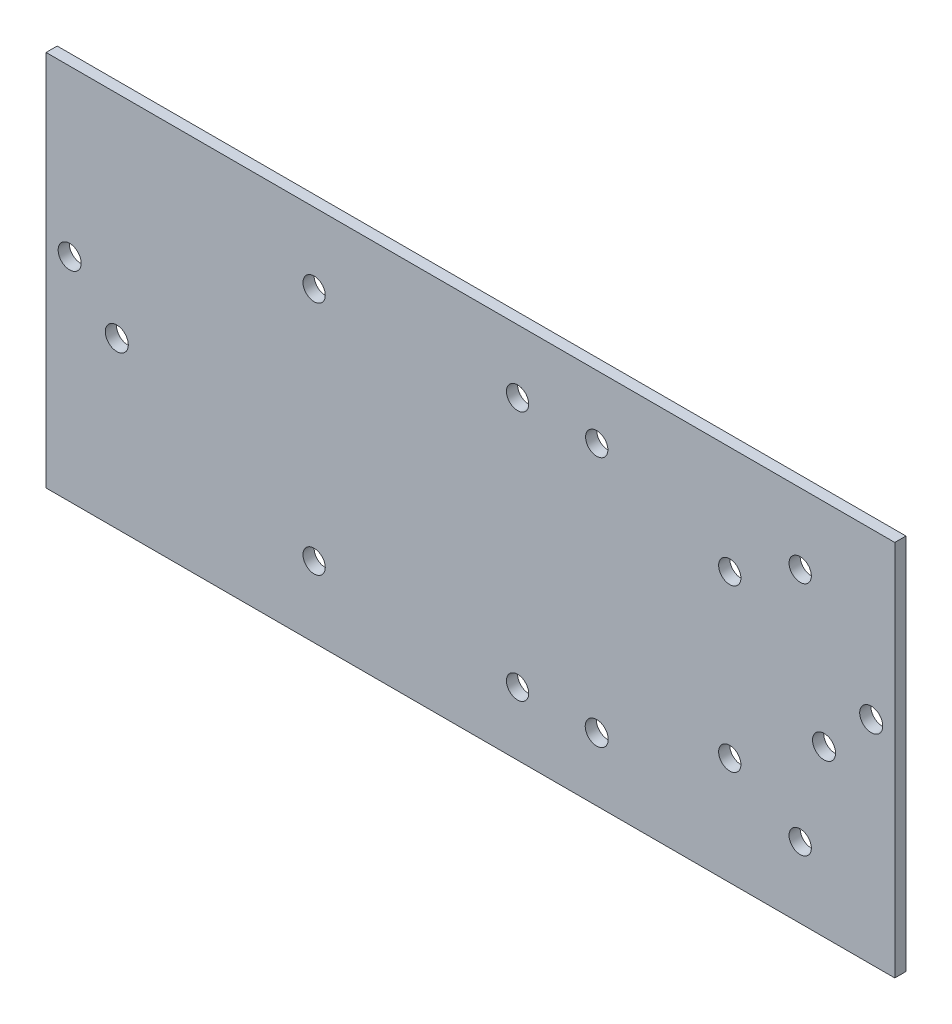
from build123d import *

# Parameters (mm, degrees)
SKETCH1_W          = 114.3
SKETCH1_H          = 50.8
EXTRUDE1_DEPTH     = 1.5
SKETCH2_R          = 1.55
CUT_EXTRUDE1_DEPTH = 63.558232871
SKETCH3_R          = 1.5
SKETCH3_R_2        = 1.55
CUT_EXTRUDE2_DEPTH = 63.558232871


with BuildPart() as part:
    # Sketch1 → Extrude1 (new body)
    with BuildSketch(Plane.XY):
        Rectangle(SKETCH1_W, SKETCH1_H)
    extrude(amount=EXTRUDE1_DEPTH)

    # Sketch2 → Cut-Extrude1 (cut, through all)
    with BuildSketch(Plane.XY.offset(1.5)):
        with Locations((-53.975, 3.175)):
            Circle(SKETCH2_R)
        with Locations((-47.625, -3.175)):
            Circle(SKETCH2_R)
        with Locations((53.975, 3.175)):
            Circle(SKETCH2_R)
        with Locations((47.625, -3.175)):
            Circle(SKETCH2_R)
    extrude(amount=-CUT_EXTRUDE1_DEPTH, mode=Mode.SUBTRACT)

    # Sketch3 → Cut-Extrude2 (cut, through all)
    with BuildSketch(Plane.XY.offset(1.5)):
        with Locations((6.35, 16.875)):
            Circle(SKETCH3_R)
        with Locations((34.925, 10.875)):
            Circle(SKETCH3_R)
        with Locations((6.35, -16.875)):
            Circle(SKETCH3_R)
        with Locations((34.925, -10.875)):
            Circle(SKETCH3_R)
        with Locations((17.01, 16.875)):
            Circle(SKETCH3_R)
        with Locations((17.01, -16.875)):
            Circle(SKETCH3_R_2)
        with Locations((44.41, 15.875)):
            Circle(SKETCH3_R)
        with Locations((44.41, -15.875)):
            Circle(SKETCH3_R)
        with Locations((-21.05, 15.875)):
            Circle(SKETCH3_R)
        with Locations((-21.05, -15.875)):
            Circle(SKETCH3_R)
    extrude(amount=-CUT_EXTRUDE2_DEPTH, mode=Mode.SUBTRACT)


solid = part.part
